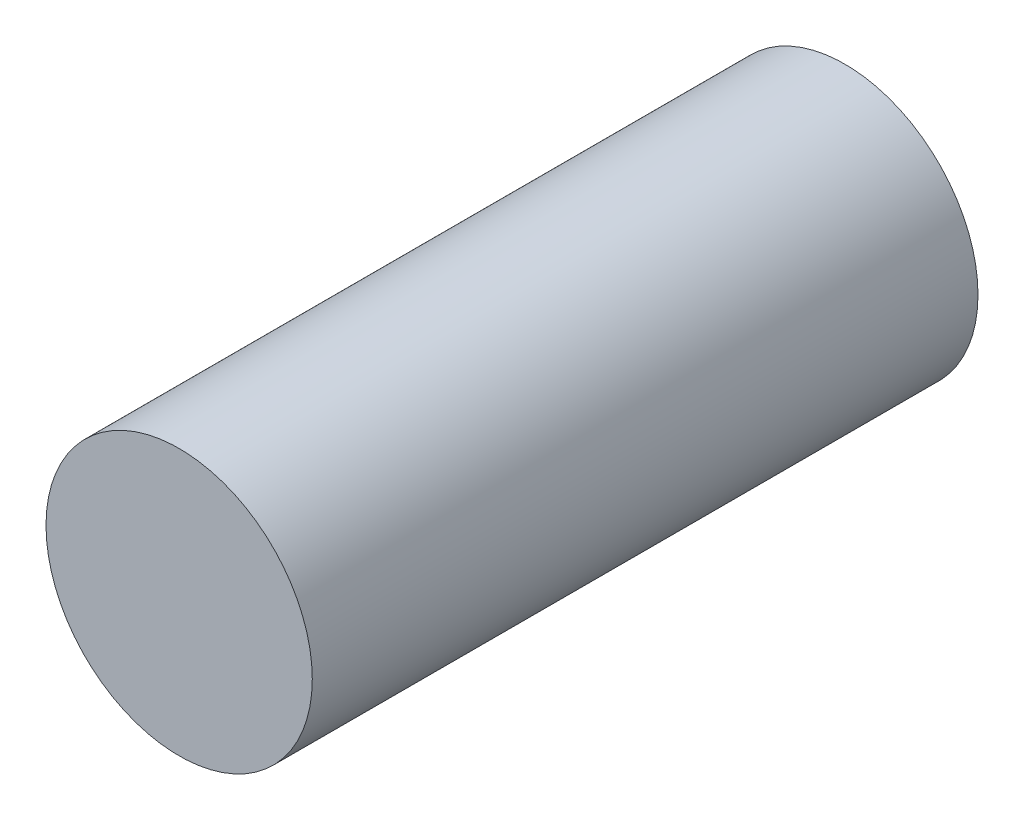
from build123d import *

# Parameters (mm, degrees)
SKETCH6_R      = 6.35
EXTRUDE2_DEPTH = 31.75


with BuildPart() as part:
    # Sketch6 → Extrude2 (new body)
    with BuildSketch(Plane.XY):
        Circle(SKETCH6_R)
    extrude(amount=EXTRUDE2_DEPTH)


solid = part.part
